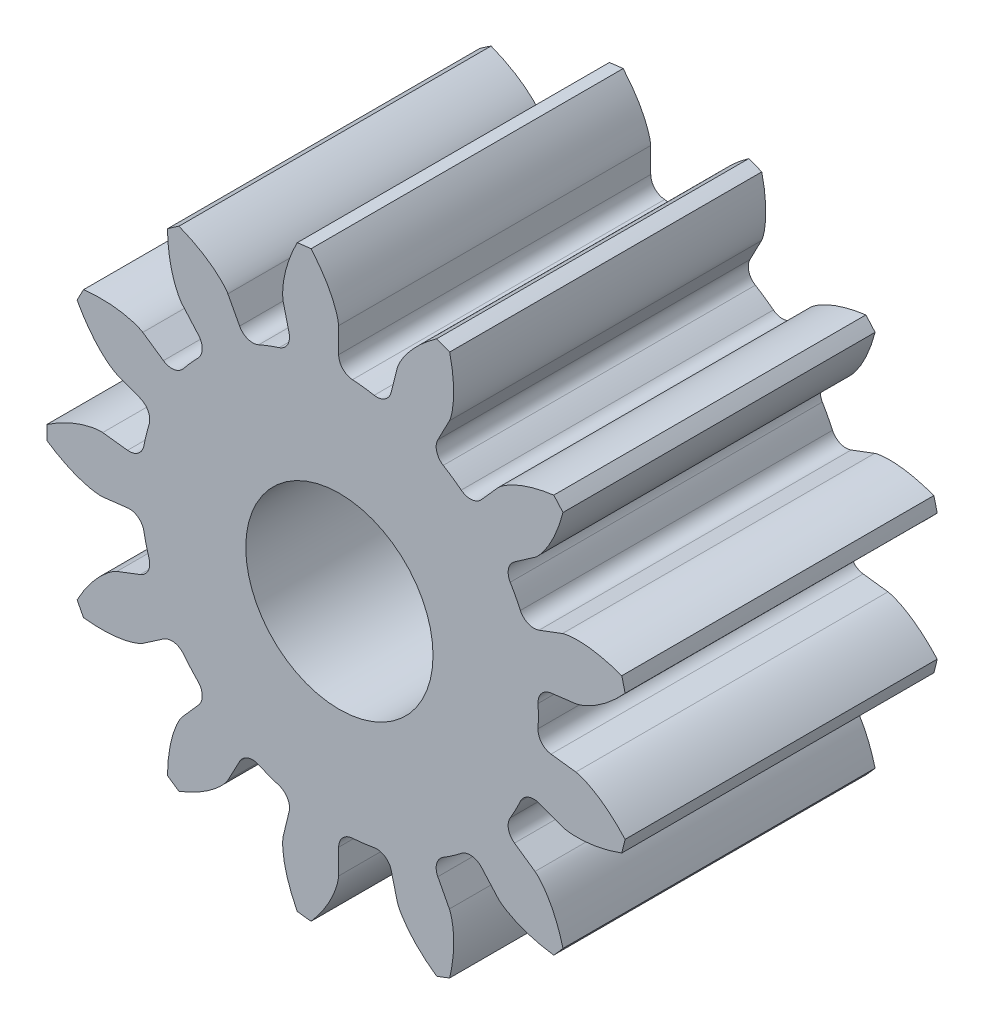
from build123d import *

# Parameters (mm, degrees)
BLANK_SKETCH_R     = 9.375
BLANK_DEPTH        = 10
TOOTH_SPACE_DEPTH  = 17.606662819
TEETH_COUNT        = 13
SKETCH1_R          = 3
CUT_EXTRUDE1_DEPTH = 10


with BuildPart() as part:
    # Blank Sketch → Blank (new body)
    with BuildSketch(Plane.XY):
        Circle(BLANK_SKETCH_R)
    extrude(amount=BLANK_DEPTH)

    # Tooth Space Sketch → Tooth Space (cut, symmetric)
    with BuildSketch(Plane.XY):
        with BuildLine():
            Line((7.576013192, 0.947252847), (6.780714286, 0.847814114))
            ThreePointArc((6.780714286, 0.847814114), (6.475036696, 0.680926043), (6.365364139, 0.350377488))
            ThreePointArc((6.365364139, 0.350377488), (6.375, 0), (6.365364139, -0.350377488))
            ThreePointArc((6.365364139, -0.350377488), (6.475036696, -0.680926043), (6.780714286, -0.847814114))
            Line((6.780714286, -0.847814114), (7.576013192, -0.947252847))
            add(Edge.make_bspline(
                [(7.576013192, -0.947252847), (7.581245619, -0.948016185), (7.59586917, -0.950488333), (7.623295115, -0.956467392), (7.667643126, -0.968060272), (7.723488768, -0.985512325), (7.794784451, -1.011112986), (7.877518009, -1.045144408), (7.966977879, -1.086548127), (8.06258059, -1.135848486), (8.156318751, -1.188744176), (8.248197976, -1.244908163), (8.338187704, -1.303887632), (8.445272177, -1.378843947), (8.570933849, -1.473571413), (8.713542772, -1.591156309), (8.870029696, -1.732472295), (9.023531676, -1.884683926), (9.169536837, -2.04109458), (9.310928972, -2.206411625), (9.443361847, -2.371511334), (9.574253101, -2.550023087), (9.691705147, -2.718415015), (9.815576422, -2.914410484), (9.913314292, -3.074766416), (10.007630197, -3.246223689), (10.052543496, -3.33051425), (10.075075836, -3.373940115)],
                knots=[0, 0, 0, 0, 0, 0.005376748, 0.015083688, 0.02853182, 0.046610139, 0.064854849, 0.092110525, 0.119476175, 0.146842495, 0.174208853, 0.201574955, 0.228941013, 0.256307345, 0.307035032, 0.361767351, 0.41649966, 0.471231936, 0.525964281, 0.580696615, 0.635428982, 0.690161387, 0.744893688, 0.799626083, 0.854358408, 0.909090916, 0.909090916, 0.909090916, 0.909090916, 0.909090916], degree=4))
            Line((10.075075836, -3.373940115), (10.075075836, 3.373940115))
            add(Edge.make_bspline(
                [(7.576013192, 0.947252847), (7.581245619, 0.948016185), (7.59586917, 0.950488333), (7.623295115, 0.956467392), (7.667643126, 0.968060272), (7.723488768, 0.985512325), (7.794784451, 1.011112986), (7.877518009, 1.045144408), (7.966977879, 1.086548127), (8.06258059, 1.135848486), (8.156318751, 1.188744176), (8.248197976, 1.244908163), (8.338187704, 1.303887632), (8.445272177, 1.378843947), (8.570933849, 1.473571413), (8.713542772, 1.591156309), (8.870029696, 1.732472295), (9.023531676, 1.884683926), (9.169536837, 2.04109458), (9.310928972, 2.206411625), (9.443361847, 2.371511334), (9.574253101, 2.550023087), (9.691705147, 2.718415015), (9.815576422, 2.914410484), (9.913314292, 3.074766416), (10.007630197, 3.246223689), (10.052543496, 3.33051425), (10.075075836, 3.373940115)],
                knots=[0, 0, 0, 0, 0, 0.005376748, 0.015083688, 0.02853182, 0.046610139, 0.064854849, 0.092110525, 0.119476175, 0.146842495, 0.174208853, 0.201574955, 0.228941013, 0.256307345, 0.307035032, 0.361767351, 0.41649966, 0.471231936, 0.525964281, 0.580696615, 0.635428982, 0.690161387, 0.744893688, 0.799626083, 0.854358408, 0.909090916, 0.909090916, 0.909090916, 0.909090916, 0.909090916], degree=4))
        make_face()
    tooth_space = extrude(amount=TOOTH_SPACE_DEPTH, both=True, mode=Mode.SUBTRACT)

    # Teeth: Tooth Space ×13 about axis
    teeth_axis = Axis((0, 0, -0.50007105), (0, 0, 1))
    for i in range(1, TEETH_COUNT):
        add(tooth_space.rotate(teeth_axis, i * 360 / TEETH_COUNT), mode=Mode.SUBTRACT)

    # Sketch1 → Cut-Extrude1 (cut)
    with BuildSketch(Plane(origin=(0, 0, 0), x_dir=(-1, 0, 0), z_dir=(0, 0, -1))):
        Circle(SKETCH1_R)
    extrude(amount=-CUT_EXTRUDE1_DEPTH, mode=Mode.SUBTRACT)


solid = part.part
